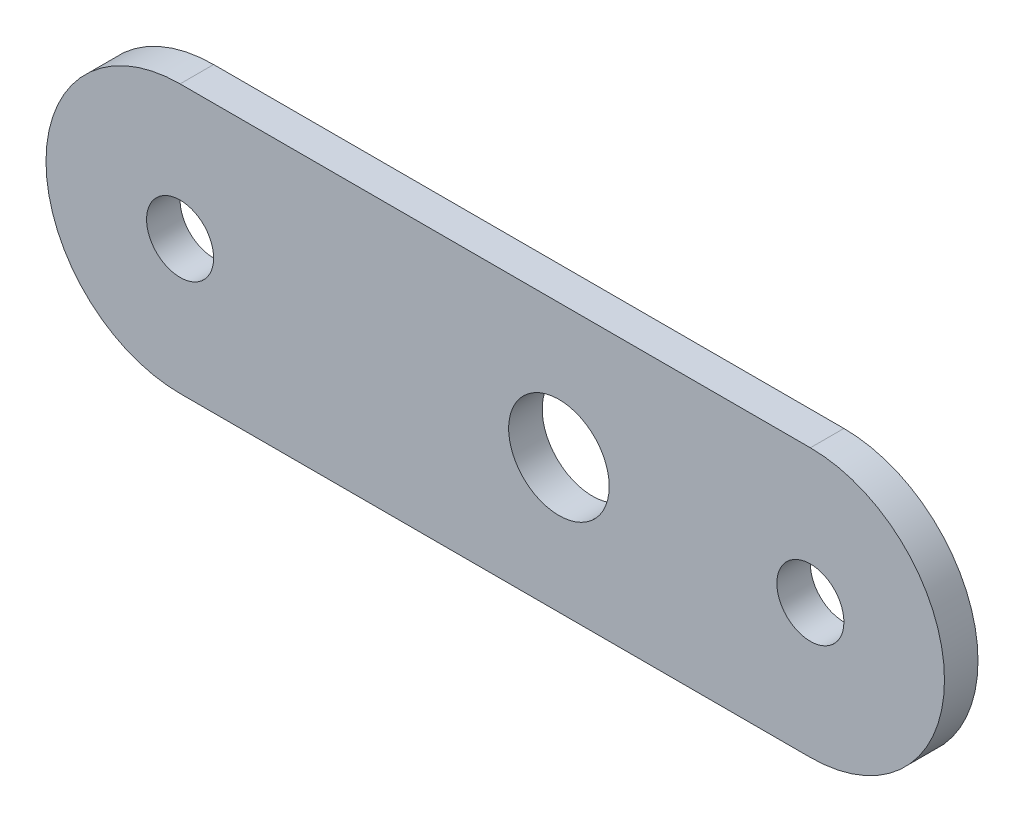
from build123d import *

# Parameters (mm, degrees)
SKETCH1_R      = 1.5
SKETCH1_R_2    = 1
EXTRUDE1_DEPTH = 1


with BuildPart() as part:
    # Sketch1 → Extrude1 (new body)
    with BuildSketch(Plane.XY):
        with BuildLine():
            ThreePointArc((-11.3, 4), (-15.3, 0), (-11.3, -4))
            Line((-11.3, -4), (7.5, -4))
            ThreePointArc((7.5, -4), (11.5, 0), (7.5, 4))
            Line((7.5, 4), (-11.3, 4))
        make_face()
        Circle(SKETCH1_R, mode=Mode.SUBTRACT)
        with Locations((-11.3, 0)):
            Circle(SKETCH1_R_2, mode=Mode.SUBTRACT)
        with Locations((7.5, 0)):
            Circle(SKETCH1_R_2, mode=Mode.SUBTRACT)
    extrude(amount=-EXTRUDE1_DEPTH)


solid = part.part
